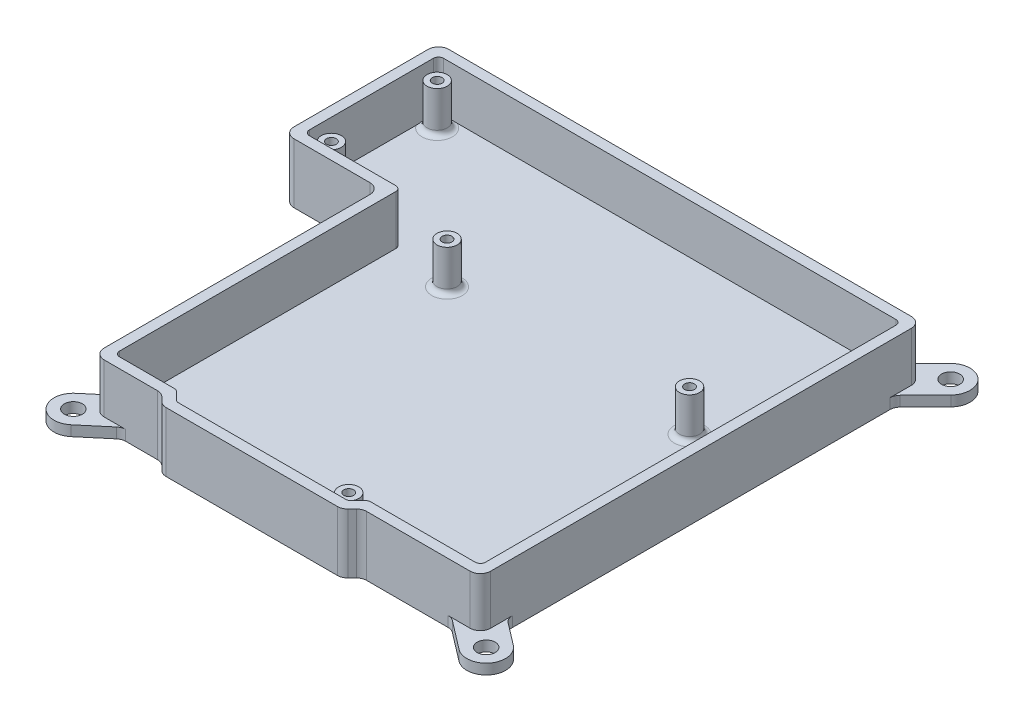
from build123d import *

# Parameters (mm, degrees)
CROQUIS2_R              = 1.7500000000001112
CROQUIS2_R_2            = 1.7499999999999087
CROQUIS2_R_3            = 1.7499999999999079
SALIENTE_EXTRUIR1_DEPTH = 2
SALIENTE_EXTRUIR2_DEPTH = 9.58
CROQUIS4_R              = 1.9500000000000126
CROQUIS4_R_2            = 0.9500000000000127
CROQUIS4_R_3            = 1.9500000000000106
CROQUIS4_R_4            = 1.9500000000282933
CROQUIS4_R_5            = 0.9500000000282915
CROQUIS4_R_6            = 1.9500000000282898
CROQUIS4_R_7            = 0.9500000000282917
SALIENTE_EXTRUIR3_DEPTH = 8
REDONDEO2_R             = 2
REDONDEO3_R             = 1
REDONDEO4_R             = 1


with BuildPart() as part:
    # Croquis2 → Saliente-Extruir1 (new body)
    with BuildSketch(Plane(origin=(0, 0, 0), x_dir=(1, 0, 0), z_dir=(0, 1, 0))):
        with BuildLine():
            Line((-2, 3.2190806926623328), (-2.0000000000000036, 53.499996259679165))
            Line((-2.0000000000000036, 53.499996259679165), (-20.72486671913368, 53.499996259679165))
            Line((-20.72486671913368, 53.499996259679165), (-20.724866719133683, 78.71718084511275))
            Line((-20.724866719133683, 78.71718084511275), (-26.65258397030698, 83.40978573734104))
            ThreePointArc((-26.65258397030698, 83.40978573734104), (-27.26521333266674, 88.67758274029933), (-21.997416329708454, 89.29021210265908))
            Line((-21.997416329708454, 89.29021210265908), (-14.68319400447552, 83.49999741935251))
            Line((-14.68319400447552, 83.49999741935251), (67.60435576823176, 83.4999990027656))
            Line((67.60435576823176, 83.4999990027656), (73.00331926973067, 88.98146673797802))
            ThreePointArc((73.00331926973067, 88.98146673797802), (78.30646766797027, 89.0216795002617), (78.34668043025394, 83.7185311020221))
            Line((78.34668043025394, 83.7185311020221), (72.89799970000735, 78.18658638447984))
            Line((72.89799970000735, 78.18658638447984), (72.89799970000736, 3.1912085024608796))
            Line((72.89799970000736, 3.1912085024608796), (77.95175715170296, -0.6702567639373589))
            ThreePointArc((77.95175715170296, -0.6702567639373589), (78.65474416605473, -5.926758381710474), (73.39824254828162, -6.6297453960622414))
            Line((73.39824254828162, -6.6297453960622414), (67.3389855873542, -2.000000000000001))
            Line((67.3389855873542, -2.000000000000001), (50.03552927587822, -2))
            Line((50.03552927587822, -2), (48.03553073587499, -4.000001079999869))
            Line((48.03553073587499, -4.000001079999869), (13.171571275261055, -4.000001079999869))
            Line((13.171571275261055, -4.000001079999869), (11.171570195261186, -2))
            Line((11.171570195261186, -2), (3.444526744807529, -2.0000000000000018))
            Line((3.444526744807529, -2.0000000000000018), (-1.9064313781813695, -6.515838670643353))
            ThreePointArc((-1.9064313781813695, -6.515838670643353), (-7.190837740651284, -6.068569851826156), (-6.743568921834085, -0.7841634893562427))
            Line((-6.743568921834085, -0.7841634893562427), (-2, 3.2190806926623328))
        make_face()
        with Locations(Location((75.6749998499923, 86.34999892000006, 0), (0, 0, 270))):
            Circle(CROQUIS2_R, mode=Mode.SUBTRACT)
        with Locations(Location((75.67499984999229, -3.6500010799997984, 0), (0, 0, 270))):
            Circle(CROQUIS2_R_2, mode=Mode.SUBTRACT)
        with Locations(Location((-4.325000150007727, -3.6500010799997984, 0), (0, 0, 270))):
            Circle(CROQUIS2_R_3, mode=Mode.SUBTRACT)
        with Locations(Location((-24.325000150007718, 86.34999892000006, 0), (0, 0, 270))):
            Circle(CROQUIS2_R, mode=Mode.SUBTRACT)
    extrude(amount=SALIENTE_EXTRUIR1_DEPTH)

    # Croquis3 → Saliente-Extruir2 (add)
    with BuildSketch(Plane(origin=(0, 2, 0), x_dir=(1, 0, 0), z_dir=(0, 1, 0))):
        Polygon((-20.72486671913368, 83.49999730309598), (72.89799970000735, 83.49999910462824), (72.89799970000735, -2), (50.03552927587822, -2), (48.03553073587499, -4.000001079999869), (13.171571275261055, -4.000001079999869), (11.171570195261186, -2), (-2.0000000000000036, -2), (-2.0000000000000036, 53.499996259679165), (-20.72486671913368, 53.499996259679165), align=None)
        Polygon((70.89799970000735, 81.49999906614336), (70.89799970000736, 0), (49.20710140718407, 0), (47.20710286718084, -2.000001079999869), (13.999998400007245, -2.000001079999869), (11.99999732000738, 0), (-3.47e-15, 0), (-3.47e-15, 55.499996259679165), (-18.72486671913368, 55.499996259679165), (-18.72486671913368, 81.49999734158087), align=None, mode=Mode.SUBTRACT)
    extrude(amount=SALIENTE_EXTRUIR2_DEPTH)

    # Croquis4 → Saliente-Extruir3 (add)
    # profile 1 of 5: a face of its own
    with BuildSketch(Plane(origin=(0, 2, 0), x_dir=(1, 0, 0), z_dir=(0, 1, 0))):
        with Locations(Location((-16.224866719133676, 78.74999625967915, 0), (0, 0, 270))):
            Circle(CROQUIS4_R)
        with Locations(Location((-16.224866719133676, 78.74999625967915, 0), (0, 0, 270))):
            Circle(CROQUIS4_R_2, mode=Mode.SUBTRACT)
    # profile 2 of 5: a face of its own
    with BuildSketch(Plane(origin=(0, 2, 0), x_dir=(1, 0, 0), z_dir=(0, 1, 0))):
        with Locations(Location((-16.22486671913367, 58.24999625967897, 0), (0, 0, 270))):
            Circle(CROQUIS4_R_3)
        with Locations(Location((-16.22486671913367, 58.24999625967897, 0), (0, 0, 270))):
            Circle(CROQUIS4_R_2, mode=Mode.SUBTRACT)
    # profile 3 of 5: a face of its own
    with BuildSketch(Plane(origin=(0, 2, 0), x_dir=(1, 0, 0), z_dir=(0, 1, 0))):
        with Locations(Location((11.369998580007247, 53.06999900000009, 0), (0, 0, 270))):
            Circle(CROQUIS4_R_4)
        with Locations(Location((11.369998580007247, 53.06999900000009, 0), (0, 0, 270))):
            Circle(CROQUIS4_R_5, mode=Mode.SUBTRACT)
    # profile 4 of 5: a face of its own
    with BuildSketch(Plane(origin=(0, 2, 0), x_dir=(1, 0, 0), z_dir=(0, 1, 0))):
        with Locations(Location((59.62999858000725, 51.799998999999985, 0), (0, 0, 270))):
            Circle(CROQUIS4_R_6)
        with Locations(Location((59.62999858000725, 51.799998999999985, 0), (0, 0, 270))):
            Circle(CROQUIS4_R_5, mode=Mode.SUBTRACT)
    # profile 5 of 5: a face of its own
    with BuildSketch(Plane(origin=(0, 2, 0), x_dir=(1, 0, 0), z_dir=(0, 1, 0))):
        with Locations(Location((44.38999858000725, 0.9999990000000292, 0), (0, 0, 270))):
            Circle(CROQUIS4_R_6)
        with Locations(Location((44.38999858000725, 0.9999990000000292, 0), (0, 0, 270))):
            Circle(CROQUIS4_R_7, mode=Mode.SUBTRACT)
    extrude(amount=SALIENTE_EXTRUIR3_DEPTH)

    # Redondeo2
    redondeo2_edges = [part.edges().sort_by_distance(p)[0] for p in [
        (-2, 1, -3.2190806926623328),
        (-2.0000000000000036, 5.79, -53.499996259679165),
        (-20.72486671913368, 5.79, -53.499996259679165),
        (-20.724866719133683, 1, -78.71718084511275),
        (-14.68319400447552, 1, -83.49999741935251),
        (67.60435576823176, 1, -83.4999990027656),
        (72.89799970000735, 1, -78.18658638447984),
        (72.89799970000736, 1, -3.1912085024608796),
        (67.3389855873542, 1, 2.000000000000001),
        (50.03552927587822, 5.79, 2),
        (48.03553073587499, 5.79, 4.000001079999869),
        (13.171571275261055, 5.79, 4.000001079999869),
        (11.171570195261186, 5.79, 2),
        (3.444526744807529, 1, 2.0000000000000018),
        (-20.72486671913368, 6.79, -83.49999730309598),
        (-2.0000000000000036, 6.79, 2),
        (72.89799970000735, 6.79, 2),
        (72.89799970000735, 6.79, -83.49999910462824),
    ]]
    fillet(redondeo2_edges, radius=REDONDEO2_R)

    # Redondeo3
    redondeo3_edges = [part.edges().sort_by_distance(p)[0] for p in [
        (-3.47e-15, 6.79, -55.499996259679165),
        (-3.47e-15, 6.79, 0),
        (11.99999732000738, 6.79, 0),
        (13.999998400007245, 6.79, 2.000001079999869),
        (47.20710286718084, 6.79, 2.000001079999869),
        (49.20710140718407, 6.79, 0),
        (70.89799970000736, 6.79, 0),
        (70.89799970000735, 6.79, -81.49999906614336),
        (-18.72486671913368, 6.79, -81.49999734158087),
        (-18.72486671913368, 6.79, -55.499996259679165),
    ]]
    fillet(redondeo3_edges, radius=REDONDEO3_R)

    # Redondeo4
    # the kernel refuses this fillet: 1 mm, written as the material it adds along each edge
    with BuildSketch(Plane(origin=(-16.224866719133676, 2, -78.74999625967915), x_dir=(0, 0, 1), z_dir=(-1, 0, 0))) as redondeo4_piece_1:
        with BuildLine():
            CenterArc((1.950000000000017 + REDONDEO4_R, REDONDEO4_R), REDONDEO4_R, 180, 90)
            Line((1.950000000000017, REDONDEO4_R), (1.950000000000017, 0))
            Line((1.950000000000017, 0), (1.950000000000017 + REDONDEO4_R, 0))
        make_face()
    revolve(axis=Axis((-16.224866719133676, 2, -78.74999625967915), (0, 1, 0)))
    with BuildSketch(Plane(origin=(-16.22486671913367, 2, -58.24999625967897), x_dir=(0, 0, 1), z_dir=(-1, 0, 0))) as redondeo4_piece_2:
        with BuildLine():
            CenterArc((1.95000000000001 + REDONDEO4_R, REDONDEO4_R), REDONDEO4_R, 180, 90)
            Line((1.95000000000001, REDONDEO4_R), (1.95000000000001, 0))
            Line((1.95000000000001, 0), (1.95000000000001 + REDONDEO4_R, 0))
        make_face()
    revolve(axis=Axis((-16.22486671913367, 2, -58.24999625967897), (0, 1, 0)))
    with BuildSketch(Plane(origin=(11.369998580007247, 2, -53.06999900000009), x_dir=(0, 0, 1), z_dir=(-1, 0, 0))) as redondeo4_piece_3:
        with BuildLine():
            CenterArc((1.9500000000282967 + REDONDEO4_R, REDONDEO4_R), REDONDEO4_R, 180, 90)
            Line((1.9500000000282967, REDONDEO4_R), (1.9500000000282967, 0))
            Line((1.9500000000282967, 0), (1.9500000000282967 + REDONDEO4_R, 0))
        make_face()
    revolve(axis=Axis((11.369998580007247, 2, -53.06999900000009), (0, 1, 0)))
    with BuildSketch(Plane(origin=(59.62999858000725, 2, -51.799998999999985), x_dir=(0, 0, 1), z_dir=(-1, 0, 0))) as redondeo4_piece_4:
        with BuildLine():
            CenterArc((1.9500000000282895 + REDONDEO4_R, REDONDEO4_R), REDONDEO4_R, 180, 90)
            Line((1.9500000000282895, REDONDEO4_R), (1.9500000000282895, 0))
            Line((1.9500000000282895, 0), (1.9500000000282895 + REDONDEO4_R, 0))
        make_face()
    revolve(axis=Axis((59.62999858000725, 2, -51.799998999999985), (0, 1, 0)))
    with BuildSketch(Plane(origin=(44.38999858000725, 2, -0.9999990000000292), x_dir=(0, 0, 1), z_dir=(-1, 0, 0))) as redondeo4_piece_5:
        with BuildLine():
            CenterArc((1.9500000000282898 + REDONDEO4_R, REDONDEO4_R), REDONDEO4_R, 180, 90)
            Line((1.9500000000282878, REDONDEO4_R), (1.9500000000282898, 0))
            Line((1.9500000000282898, 0), (1.9500000000282898 + REDONDEO4_R, 0))
        make_face()
    revolve(axis=Axis((44.38999858000725, 2, -0.9999990000000292), (0, 1, 0)))


solid = part.part
